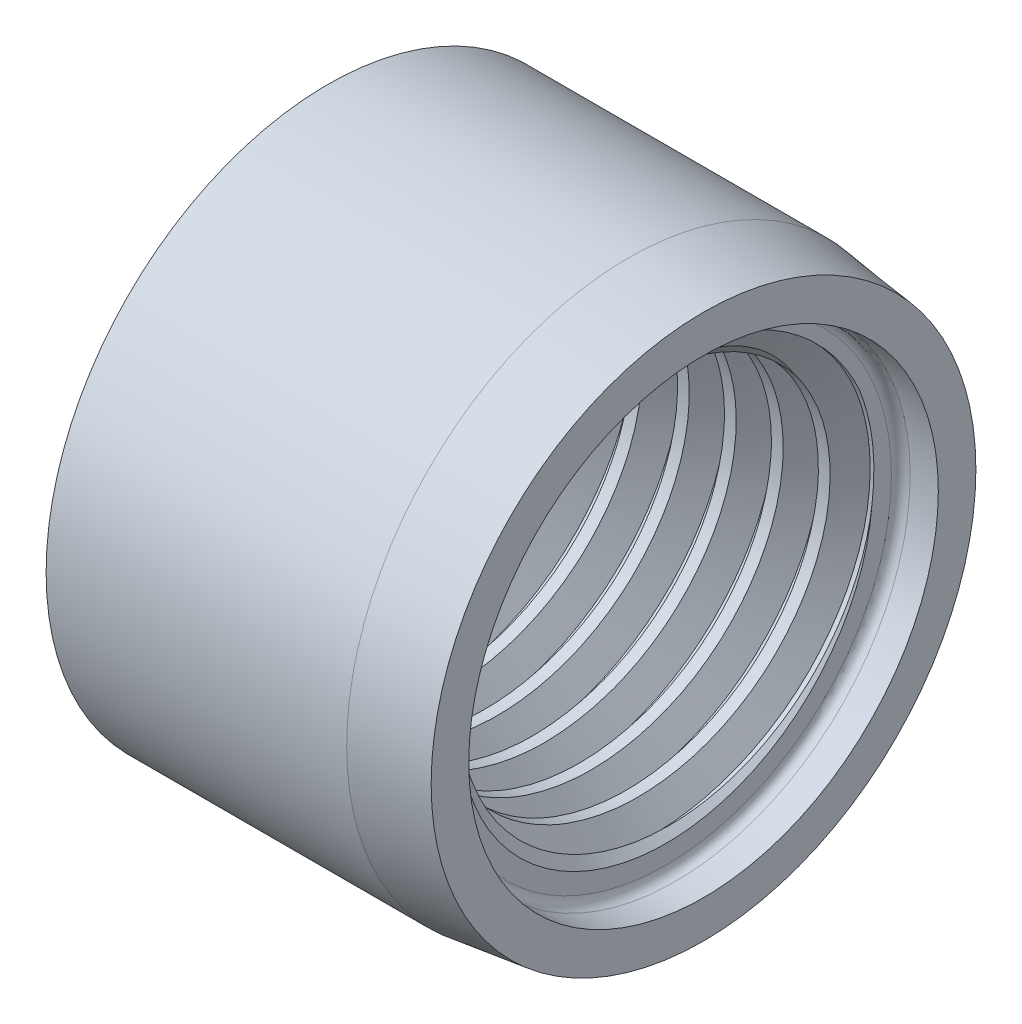
from build123d import *

# Parameters (mm, degrees)
THREAD2_PITCH = 1.25


with BuildPart() as part:
    # Sketch1 → Revolve1 (revolve)
    with BuildSketch(Plane.XY, mode=Mode.PRIVATE) as revolve1_sk:
        with BuildLine():
            Line((0.866025404, 5), (8.5, 5))
            Line((8.5, 5), (9, 5.5))
            Line((9, 5.5), (9, 6))
            ThreePointArc((9, 6), (9.073223305, 6.176776695), (9.25, 6.25))
            Line((9.25, 6.25), (10, 6.25))
            Line((10, 6.25), (10, 7.25))
            Line((10, 7.25), (8, 7.5))
            Line((8, 7.5), (0, 7.5))
            Line((0, 7.5), (0, 6.5))
            Line((0, 6.5), (0.866025404, 5))
        make_face()
    revolve(revolve1_sk.sketch.rotate(Axis((-88.99, 0, 0), (1, 0, 0)), 90), axis=Axis((-88.99, 0, 0), (1, 0, 0)))

    # Thread2: the profile of Thread Profile2 profile screwed along a right-hand helix of 16 turns, 8 arcs to a turn; built about Z, then put on its axis
    thread2_z = Axis((0, 0, 0), (0, 0, 1))
    thread2_corners = [(4.9997, 0, -0.000173205), (5.676582344, 0, 0.390624998), (5.676582344, 0, 0.546874998), (4.9997, 0, 0.937673201)]
    with BuildLine(mode=Mode.PRIVATE) as thread2_profile:
        Line(thread2_corners[0], thread2_corners[1])
        Line(thread2_corners[1], thread2_corners[2])
        Line(thread2_corners[2], thread2_corners[3])
        Line(thread2_corners[3], thread2_corners[0])
    thread2_cap = Face(thread2_profile.wire())
    thread2_turn_angles = [0, 22.5, 45, 67.5, 90, 112.5, 135, 157.5, 180, 202.5, 225, 247.5, 270, 292.5, 315, 337.5, 360]
    thread2_turn_weights = [1, 0.9238795325112867, 1, 0.9238795325112867, 1, 0.9238795325112867, 1, 0.9238795325112867, 1, 0.9238795325112867, 1, 0.9238795325112867, 1, 0.9238795325112867, 1, 0.9238795325112867, 1]
    thread2_turn_rails = [Edge.make_bspline([Vector(p[0], p[1], 0).rotate(thread2_z, thread2_turn_angles[k]) / thread2_turn_weights[k] + Vector(0, 0, p[2] + THREAD2_PITCH * thread2_turn_angles[k] / 360) for k in range(17)], [0, 0, 0, 1, 1, 2, 2, 3, 3, 4, 4, 5, 5, 6, 6, 7, 7, 8, 8, 8], 2, thread2_turn_weights) for p in thread2_corners]
    thread2_turn_sides = [Face.make_surface_from_curves(thread2_turn_rails[p[0]], thread2_turn_rails[p[1]]) for p in [(0, 1), (1, 2), (2, 3), (3, 0)]]
    thread2 = Plane(origin=(-0.383974596, 0, 0), x_dir=(0, 0, -1), z_dir=(1, 0, 0)) * Solid(Shell([*[p.moved(Location((0, 0, THREAD2_PITCH * i))) for i in range(16) for p in thread2_turn_sides], thread2_cap, thread2_cap.rotate(thread2_z, 5760).moved(Location((0, 0, THREAD2_PITCH * 5760 / 360)))]))
    add(thread2, mode=Mode.SUBTRACT)


solid = part.part
